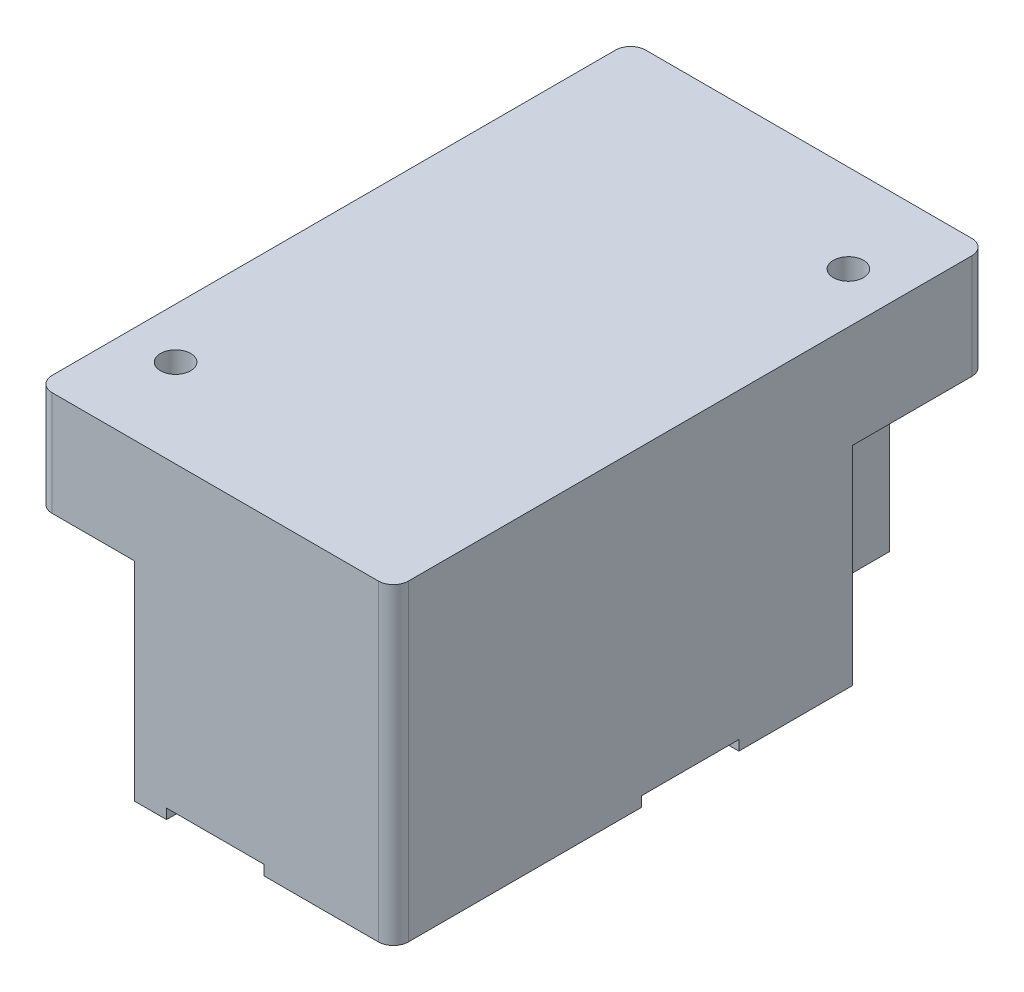
from build123d import *

# Parameters (mm, degrees)
BOSS_EXTRUDE1_DEPTH      = 15.7988
SKETCH2_W                = 19.737735158
SKETCH2_H                = 30.99863248
CUT_EXTRUDE1_DEPTH       = 10.5156
SKETCH3_W                = 23.747664657
SKETCH3_H                = 36.806359235
CUT_EXTRUDE2_DEPTH       = 0.508
BOSS_EXTRUDE2_DEPTH      = 3.7211
BOSS_EXTRUDE2_DEPTH_BACK = 3.7211
BOSS_EXTRUDE3_DEPTH      = 3.7211
BOSS_EXTRUDE3_DEPTH_BACK = 3.7211
CUT_EXTRUDE3_DEPTH       = 6.223
CUT_EXTRUDE3_DEPTH_BACK  = 6.223
SKETCH7_W                = 7.924156623
SKETCH7_H                = 10.866582427
CUT_EXTRUDE4_DEPTH       = 0.5588
SKETCH8_R                = 0.762
CUT_EXTRUDE5_DEPTH       = 5.2832
SKETCH9_R                = 0.762
CUT_EXTRUDE6_DEPTH       = 5.2832


with BuildPart() as part:
    # Sketch1 → Boss-Extrude1 (new body)
    with BuildSketch(Plane(origin=(0, 0, 0), x_dir=(1, 0, 0), z_dir=(0, 1, 0))):
        with BuildLine():
            Line((-9.0043, 14.2367), (-9.0043, -14.2367))
            ThreePointArc((-9.0043, -14.2367), (-8.781115367, -14.775515367), (-8.2423, -14.9987))
            Line((-8.2423, -14.9987), (8.2423, -14.9987))
            ThreePointArc((8.2423, -14.9987), (8.781115367, -14.775515367), (9.0043, -14.2367))
            Line((9.0043, -14.2367), (9.0043, 14.2367))
            ThreePointArc((9.0043, 14.2367), (8.781115367, 14.775515367), (8.2423, 14.9987))
            Line((8.2423, 14.9987), (-8.2423, 14.9987))
            ThreePointArc((-8.2423, 14.9987), (-8.781115367, 14.775515367), (-9.0043, 14.2367))
        make_face()
    extrude(amount=-BOSS_EXTRUDE1_DEPTH)

    # Sketch2 → Cut-Extrude1 (cut)
    with BuildSketch(Plane(origin=(0, -15.7988, 0), x_dir=(1, 0, 0), z_dir=(0, 1, 0))):
        with Locations((0, 0.12465938)):
            Rectangle(SKETCH2_W, SKETCH2_H)
        Polygon((-9.0043, 14.9987), (-9.0043, -8.2169), (-4.0767, -8.2169), (-4.0767, -14.9987), (9.0043, -14.9987), (9.0043, 8.2169), (4.0767, 8.2169), (4.0767, 14.9987), align=None, mode=Mode.SUBTRACT)
    extrude(amount=CUT_EXTRUDE1_DEPTH, mode=Mode.SUBTRACT)

    # Sketch3 → Cut-Extrude2 (cut)
    with BuildSketch(Plane(origin=(0, -15.7988, 0), x_dir=(1, 0, 0), z_dir=(0, 1, 0))):
        with Locations((-1.320221966, 0.05041967)):
            Rectangle(SKETCH3_W, SKETCH3_H)
        with BuildLine():
            Line((-11.580624848, -17.697304235), (-2.4638, -17.697304235))
            Line((-2.4638, -17.697304235), (-2.4638, -6.8834))
            ThreePointArc((-2.4638, -6.8834), (-2.240615367, -6.344584633), (-1.7018, -6.1214))
            Line((-1.7018, -6.1214), (1.7018, -6.1214))
            ThreePointArc((1.7018, -6.1214), (2.240615367, -6.344584633), (2.4638, -6.8834))
            Line((2.4638, -6.8834), (2.4638, -17.697304235))
            Line((2.4638, -17.697304235), (9.293118608, -17.697304235))
            Line((9.293118608, -17.697304235), (9.293118608, -2.4638))
            Line((9.293118608, -2.4638), (-2.3114, -2.4638))
            ThreePointArc((-2.3114, -2.4638), (-2.850215367, -2.240615367), (-3.0734, -1.7018))
            Line((-3.0734, -1.7018), (-3.0734, 1.7018))
            ThreePointArc((-3.0734, 1.7018), (-2.850215367, 2.240615367), (-2.3114, 2.4638))
            Line((-2.3114, 2.4638), (9.293118608, 2.4638))
            Line((9.293118608, 2.4638), (9.293118608, 17.495625554))
            Line((9.293118608, 17.495625554), (2.4638, 17.495625554))
            Line((2.4638, 17.495625554), (2.4638, 6.8834))
            ThreePointArc((2.4638, 6.8834), (2.240615367, 6.344584633), (1.7018, 6.1214))
            Line((1.7018, 6.1214), (-1.7018, 6.1214))
            ThreePointArc((-1.7018, 6.1214), (-2.240615367, 6.344584633), (-2.4638, 6.8834))
            Line((-2.4638, 6.8834), (-2.4638, 17.495625554))
            Line((-2.4638, 17.495625554), (-11.580624848, 17.495625554))
            Line((-11.580624848, 17.495625554), (-11.580624848, -17.697304235))
        make_face(mode=Mode.SUBTRACT)
    extrude(amount=CUT_EXTRUDE2_DEPTH, mode=Mode.SUBTRACT)

    # Sketch4 → Boss-Extrude2 (add, two sides: drawn at the far end of the back side and taken through both)
    with BuildSketch(Plane(origin=(0, 0, 0), x_dir=(0, 0, -1), z_dir=(1, 0, 0)).offset(-BOSS_EXTRUDE2_DEPTH_BACK)):
        with BuildLine():
            Line((5.1816, -15.7988), (3.2004, -15.7988))
            ThreePointArc((3.2004, -15.7988), (4.191, -16.3576), (5.1816, -15.7988))
        make_face()
    extrude(amount=BOSS_EXTRUDE2_DEPTH + BOSS_EXTRUDE2_DEPTH_BACK)

    # Sketch5 → Boss-Extrude3 (add, two sides: drawn at the far end of the back side and taken through both)
    with BuildSketch(Plane(origin=(0, 0, 0), x_dir=(0, 0, -1), z_dir=(1, 0, 0)).offset(-BOSS_EXTRUDE3_DEPTH_BACK)):
        with BuildLine():
            Line((-3.2004, -15.7988), (-5.1816, -15.7988))
            ThreePointArc((-5.1816, -15.7988), (-4.191, -16.3576), (-3.2004, -15.7988))
        make_face()
    extrude(amount=BOSS_EXTRUDE3_DEPTH + BOSS_EXTRUDE3_DEPTH_BACK)

    # Sketch6 → Cut-Extrude3 (cut, two sides: drawn at the far end of the back side and taken through both)
    with BuildSketch(Plane.XY.offset(-CUT_EXTRUDE3_DEPTH_BACK)):
        with BuildLine():
            Line((-3.7211, -16.1798), (-3.7211, -17.06431814))
            Line((-3.7211, -17.06431814), (4.069268489, -17.06431814))
            Line((4.069268489, -17.06431814), (4.069268489, -16.1798))
            Line((4.069268489, -16.1798), (3.7211, -16.1798))
            ThreePointArc((3.7211, -16.1798), (3.431567311, -16.583928151), (2.9591, -16.7386))
            Line((2.9591, -16.7386), (-2.9591, -16.7386))
            ThreePointArc((-2.9591, -16.7386), (-3.431567311, -16.583928151), (-3.7211, -16.1798))
        make_face()
    extrude(amount=CUT_EXTRUDE3_DEPTH + CUT_EXTRUDE3_DEPTH_BACK, mode=Mode.SUBTRACT)

    # Sketch7 → Cut-Extrude4 (cut)
    with BuildSketch(Plane(origin=(0, -15.7988, 0), x_dir=(1, 0, 0), z_dir=(0, 1, 0))):
        with Locations((-0.021849697, 0.014566465)):
            Rectangle(SKETCH7_W, SKETCH7_H)
        with BuildLine():
            Line((-3.2131, 3.2766), (3.2131, 3.2766))
            ThreePointArc((3.2131, 3.2766), (3.572310245, 3.425389755), (3.7211, 3.7846))
            Line((3.7211, 3.7846), (3.7211, 4.7498))
            ThreePointArc((3.7211, 4.7498), (3.572310245, 5.109010245), (3.2131, 5.2578))
            Line((3.2131, 5.2578), (-3.2131, 5.2578))
            ThreePointArc((-3.2131, 5.2578), (-3.572310245, 5.109010245), (-3.7211, 4.7498))
            Line((-3.7211, 4.7498), (-3.7211, 3.7846))
            ThreePointArc((-3.7211, 3.7846), (-3.572310245, 3.425389755), (-3.2131, 3.2766))
        make_face(mode=Mode.SUBTRACT)
        with BuildLine():
            Line((-3.2131, -5.2578), (3.2131, -5.2578))
            ThreePointArc((3.2131, -5.2578), (3.572310245, -5.109010245), (3.7211, -4.7498))
            Line((3.7211, -4.7498), (3.7211, -3.7846))
            ThreePointArc((3.7211, -3.7846), (3.572310245, -3.425389755), (3.2131, -3.2766))
            Line((3.2131, -3.2766), (-3.2131, -3.2766))
            ThreePointArc((-3.2131, -3.2766), (-3.572310245, -3.425389755), (-3.7211, -3.7846))
            Line((-3.7211, -3.7846), (-3.7211, -4.7498))
            ThreePointArc((-3.7211, -4.7498), (-3.572310245, -5.109010245), (-3.2131, -5.2578))
        make_face(mode=Mode.SUBTRACT)
    extrude(amount=-CUT_EXTRUDE4_DEPTH, mode=Mode.SUBTRACT)

    # Sketch8 → Cut-Extrude5 (cut)
    with BuildSketch(Plane(origin=(0, 0, 0), x_dir=(1, 0, 0), z_dir=(0, 1, 0))):
        with Locations((6.4643, 10.541)):
            Circle(SKETCH8_R)
    extrude(amount=-CUT_EXTRUDE5_DEPTH, mode=Mode.SUBTRACT)

    # Sketch9 → Cut-Extrude6 (cut)
    with BuildSketch(Plane(origin=(0, 0, 0), x_dir=(1, 0, 0), z_dir=(0, 1, 0))):
        with Locations((-6.4643, -10.541)):
            Circle(SKETCH9_R)
    extrude(amount=-CUT_EXTRUDE6_DEPTH, mode=Mode.SUBTRACT)


solid = part.part
